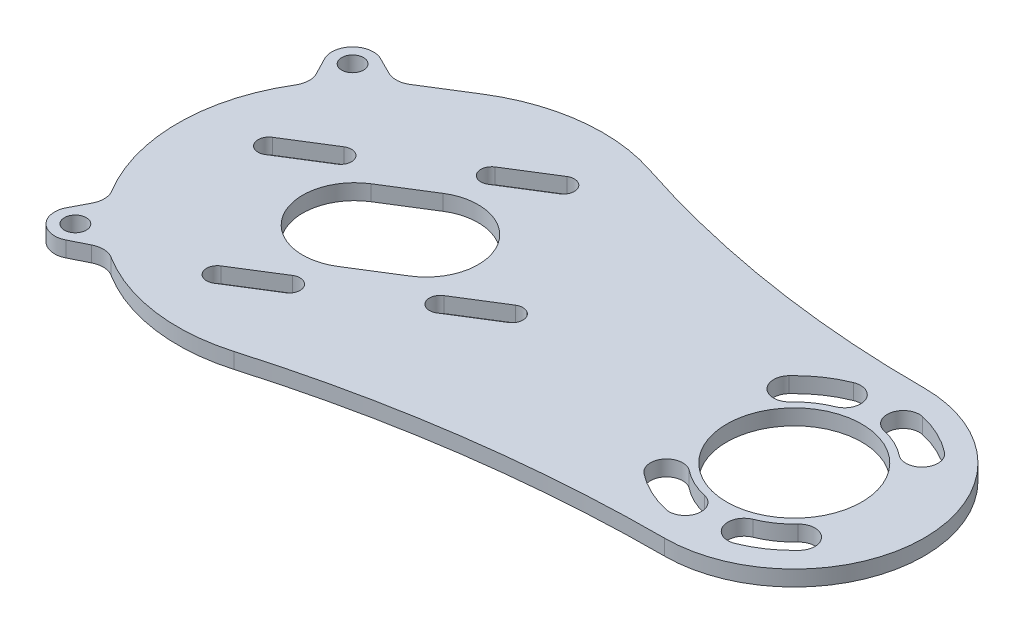
from build123d import *

# Parameters (mm, degrees)
SKETCH_2_R               = 13
EXTRUDE_1_DEPTH          = 3
CUT_EXTRUDE_2_DEPTH      = 110.084751045
PATTERN_CURVE_1_DEPTH    = 3
CUT_EXTRUDE_4_DEPTH      = 110.084751045
PATTERN_CIRCULAR_1_COUNT = 6
EXTRUDE_2_DEPTH          = 3
HOLE_WIZARD_M4_1_D       = 4.2
FILLET_1_R               = 4


# Read off the part's stored shape, not the designer's step: 곡선 패턴1
with BuildPart() as part:
    # 스케치2 → 보스-돌출1 (new body)
    with BuildSketch(Plane(origin=(0, 0, 0), x_dir=(1, 0, 0), z_dir=(0, 1, 0))):
        with BuildLine():
            ThreePointArc((77.639466647, 24.999926714), (45.838842968, 27.466341176), (14.834721753, 34.956824097))
            ThreePointArc((14.834721753, 34.956824097), (0.14257607, 36.40176879), (-13.777014503, 31.48323159))
            Line((-13.777014503, 31.48323159), (-22.257495465, 26.184038948))
            ThreePointArc((-22.257495465, 26.184038948), (-35.278632699, -16.528292532), (5.235906124, -35.302354942))
            ThreePointArc((5.235906124, -35.302354942), (41.103608721, -27.588473828), (77.7, -25))
            ThreePointArc((77.7, -25), (102.699981679, 0.030266699), (77.639466647, 24.999926714))
        make_face()
        with BuildLine():
            Line((-9.539433123, 5.83088464), (-1.058952162, 11.130077283))
            ThreePointArc((-1.058952162, 11.130077283), (12.720721442, 7.948788963), (9.539433123, -5.83088464))
            Line((9.539433123, -5.83088464), (1.058952162, -11.130077283))
            ThreePointArc((1.058952162, -11.130077283), (-12.720721442, -7.948788963), (-9.539433123, 5.83088464))
        make_face(mode=Mode.SUBTRACT)
        with Locations(Location((77.7, 0, 0), (0, 0, 270))):
            Circle(SKETCH_2_R, mode=Mode.SUBTRACT)
    extrude(amount=EXTRUDE_1_DEPTH)

    # 스케치4 → 컷-돌출2 (cut, through all)
    with BuildSketch(Plane(origin=(0, 0, 0), x_dir=(-1, 0, 0), z_dir=(0, -1, 0))):
        with BuildLine():
            Line((1.82151317, -17.005644102), (10.301994131, -22.304836745))
            ThreePointArc((10.301994131, -22.304836745), (10.970064678, -25.198568201), (8.076333221, -25.866638748))
            Line((8.076333221, -25.866638748), (-0.40414774, -20.567446106))
            ThreePointArc((-0.40414774, -20.567446106), (-1.072218287, -17.673714649), (1.82151317, -17.005644102))
        make_face()
    extrude(amount=-CUT_EXTRUDE_2_DEPTH, mode=Mode.SUBTRACT)

    # 곡선 패턴1 outline → 곡선 패턴1 (cut)
    with BuildSketch(Plane(origin=(0, 0, 0), x_dir=(1, 0, 0), z_dir=(0, 1, 0))):
        with BuildLine():
            Line((24.563551451, -0.518425872), (16.08307049, -5.817618515))
            ThreePointArc((16.08307049, -5.817618515), (15.414999943, -8.711349971), (18.308731399, -9.379420519))
            Line((18.308731399, -9.379420519), (26.789212361, -4.080227876))
            ThreePointArc((26.789212361, -4.080227876), (27.457282908, -1.186496419), (24.563551451, -0.518425872))
        make_face()
        with BuildLine():
            ThreePointArc((-16.08307049, 5.817618515), (-15.414999943, 8.711349971), (-18.308731399, 9.379420519))
            Line((-18.308731399, 9.379420519), (-26.789212361, 4.080227876))
            ThreePointArc((-26.789212361, 4.080227876), (-27.457282908, 1.186496419), (-24.563551451, 0.518425872))
            Line((-24.563551451, 0.518425872), (-16.08307049, 5.817618515))
        make_face()
        with BuildLine():
            Line((8.076333221, 25.866638748), (-0.40414774, 20.567446106))
            ThreePointArc((-0.40414774, 20.567446106), (-1.072218287, 17.673714649), (1.82151317, 17.005644102))
            Line((1.82151317, 17.005644102), (10.301994131, 22.304836745))
            ThreePointArc((10.301994131, 22.304836745), (10.970064678, 25.198568202), (8.076333221, 25.866638748))
        make_face()
    extrude(amount=PATTERN_CURVE_1_DEPTH, mode=Mode.SUBTRACT)

    # 스케치5 → 컷-돌출4 (cut, through all)
    with BuildSketch(Plane(origin=(0, 0, 0), x_dir=(-1, 0, 0), z_dir=(0, -1, 0))):
        with BuildLine():
            ThreePointArc((-73.066008281, -20.072023335), (-68.831471406, -18.593256858), (-65.017373608, -16.233021524))
            ThreePointArc((-65.017373608, -16.233021524), (-64.483090846, -11.881637615), (-68.834474755, -11.347354852))
            ThreePointArc((-68.834474755, -11.347354852), (-71.500640206, -12.997228095), (-74.460704817, -14.030928933))
            ThreePointArc((-74.460704817, -14.030928933), (-76.78390375, -17.748824402), (-73.066008281, -20.072023335))
        make_face()
    cut_extrude_4 = extrude(amount=-CUT_EXTRUDE_4_DEPTH, mode=Mode.SUBTRACT)

    # 원형 패턴1: 컷-돌출4 ×6 about axis, 2 skipped
    pattern_circular_1_axis = Axis((77.7, 3, 0), (0, -1, 0))
    add([cut_extrude_4.rotate(pattern_circular_1_axis, i * 360 / PATTERN_CIRCULAR_1_COUNT) for i in range(1, PATTERN_CIRCULAR_1_COUNT) if i not in (1, 4)], mode=Mode.SUBTRACT)

    # 스케치7 → 보스-돌출2 (add)
    with BuildSketch(Plane.XZ):
        with BuildLine():
            ThreePointArc((-34.857379721, -22.180465117), (-34.155886305, -26.830127811), (-29.517020915, -27.599792717))
            Line((-29.517020915, -27.599792717), (-24.147285754, -24.913232788))
            ThreePointArc((-24.147285754, -24.913232788), (-28.457668053, -21.214942262), (-32.092293027, -16.850741341))
            Line((-32.092293027, -16.850741341), (-34.857379721, -22.180465117))
        make_face()
        with BuildLine():
            ThreePointArc((-29.517020915, 32.898985359), (-34.155886305, 32.129320453), (-34.857379721, 27.479657759))
            Line((-34.857379721, 27.479657759), (-32.092293027, 22.149933984))
            ThreePointArc((-32.092293027, 22.149933984), (-28.457668053, 26.514134904), (-24.147285754, 30.21242543))
            Line((-24.147285754, 30.21242543), (-29.517020915, 32.898985359))
        make_face()
    extrude(amount=-EXTRUDE_2_DEPTH)

    # M4 나선 코일용 탭 드릴1 (through all)
    with Locations(Plane(origin=(0, 3, 0), x_dir=(1, 0, 0), z_dir=(0, 1, 0))):
        with Locations((-31.306777179, 24.022535036), (-31.306777179, -29.321727679)):
            Hole(HOLE_WIZARD_M4_1_D / 2)

    # 필렛1
    fillet_1_edges = [part.edges().sort_by_distance(p)[0] for p in [
        (-24.147285754, 1.5, -24.913232788),
        (-32.092293027, 1.5, -16.850741341),
        (-32.092293027, 1.5, 22.149933984),
        (-24.147285754, 1.5, 30.21242543),
    ]]
    fillet(fillet_1_edges, radius=FILLET_1_R)


solid = part.part
